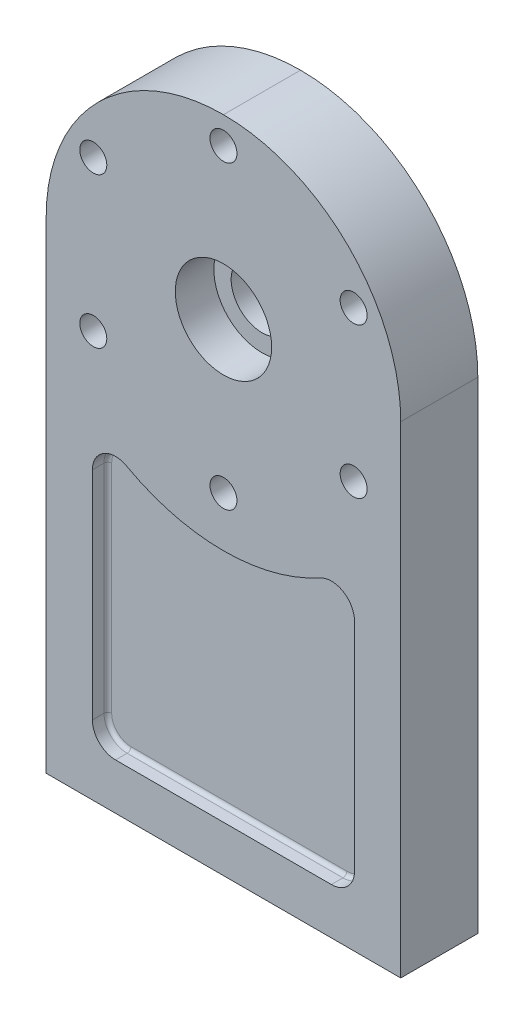
from build123d import *

# Parameters (mm, degrees)
SKETCH1_W                        = 92
SKETCH1_H                        = 171
BOSS_EXTRUDE1_DEPTH              = 10
FILLET1_R                        = 46
SKETCH3_R                        = 3.5
CUT_EXTRUDE1_DEPTH               = 100.127443223
SKETCH4_R                        = 6
CUT_EXTRUDE2_DEPTH               = 6
CIRPATTERN1_COUNT                = 6
SKETCH6_R                        = 12.5
CUT_EXTRUDE3_DEPTH               = 10
SKETCH7_R                        = 8
CUT_EXTRUDE4_DEPTH               = 100.127443223
TAP_DRILL_FOR_M10X1_5_TAP1_D     = 8.5
TAP_DRILL_FOR_M10X1_5_TAP1_DEPTH = 6
TAP_DRILL_FOR_M10X1_5_TAP1_TIP   = 4.25
CUT_EXTRUDE5_DEPTH               = 4
FILLET2_R                        = 1


with BuildPart() as part:
    # Sketch1 → Boss-Extrude1 (new, symmetric)
    with BuildSketch(Plane.XY):
        Rectangle(SKETCH1_W, SKETCH1_H)
    extrude(amount=BOSS_EXTRUDE1_DEPTH, both=True)

    # Fillet1
    fillet1_edges = [part.edges().sort_by_distance(p)[0] for p in [
        (46, 85.5, 0),
        (-46, 85.5, 0),
    ]]
    fillet(fillet1_edges, radius=FILLET1_R - 0.0001)  # a hair under: the kernel refuses the full size

    # Sketch3 → Cut-Extrude1 (cut, through all)
    with BuildSketch(Plane.XY.offset(10)):
        with Locations((0, 78.5)):
            Circle(SKETCH3_R)
    cut_extrude1 = extrude(amount=-CUT_EXTRUDE1_DEPTH, mode=Mode.SUBTRACT)

    # Sketch4 → Cut-Extrude2 (cut)
    with BuildSketch(Plane(origin=(0, 0, -10), x_dir=(-1, 0, 0), z_dir=(0, 0, -1))):
        with Locations((0, 78.5)):
            Circle(SKETCH4_R)
    cut_extrude2 = extrude(amount=-CUT_EXTRUDE2_DEPTH, mode=Mode.SUBTRACT)

    # CirPattern1: Cut-Extrude1, Cut-Extrude2 ×6 about axis
    cirpattern1_axis = Axis((0, 39.5, 0), (0, 0, 1))
    add([cut_extrude1.rotate(cirpattern1_axis, i * 360 / CIRPATTERN1_COUNT) for i in range(1, CIRPATTERN1_COUNT)], mode=Mode.SUBTRACT)
    add([cut_extrude2.rotate(cirpattern1_axis, i * 360 / CIRPATTERN1_COUNT) for i in range(1, CIRPATTERN1_COUNT)], mode=Mode.SUBTRACT)

    # Sketch6 → Cut-Extrude3 (cut)
    with BuildSketch(Plane.XY.offset(10)):
        with Locations((0, 39.5)):
            Circle(SKETCH6_R)
    extrude(amount=-CUT_EXTRUDE3_DEPTH, mode=Mode.SUBTRACT)

    # Sketch7 → Cut-Extrude4 (cut, through all)
    with BuildSketch(Plane.XY.offset(10)):
        with Locations((0, 39.5)):
            Circle(SKETCH7_R)
    extrude(amount=-CUT_EXTRUDE4_DEPTH, mode=Mode.SUBTRACT)

    # Tap Drill for M10x1.5 Tap1
    with Locations(Plane(origin=(0, -85.5, 0), x_dir=(-1, 0, 0), z_dir=(0, -1, 0))):
        with Locations((30, 0), (-30, 0)):
            Hole(TAP_DRILL_FOR_M10X1_5_TAP1_D / 2, depth=TAP_DRILL_FOR_M10X1_5_TAP1_DEPTH)
            with Locations((0, 0, -(TAP_DRILL_FOR_M10X1_5_TAP1_DEPTH + TAP_DRILL_FOR_M10X1_5_TAP1_TIP / 2))):  # 90° drill point
                Cone(0, TAP_DRILL_FOR_M10X1_5_TAP1_D / 2, TAP_DRILL_FOR_M10X1_5_TAP1_TIP, mode=Mode.SUBTRACT)

    # Sketch12 → Cut-Extrude5 (cut)
    with BuildSketch(Plane.XY.offset(10)):
        with BuildLine():
            Line((34, -67.5), (34, -11.293700397))
            ThreePointArc((34, -11.293700397), (31.051285766, -6.127497229), (25.103448276, -6.039179666))
            ThreePointArc((25.103448276, -6.039179666), (0, -12.5), (-25.103448276, -6.039179666))
            ThreePointArc((-25.103448276, -6.039179666), (-31.051285766, -6.127497229), (-34, -11.293700397))
            Line((-34, -11.293700397), (-34, -67.5))
            ThreePointArc((-34, -67.5), (-32.242640687, -71.742640687), (-28, -73.5))
            Line((-28, -73.5), (28, -73.5))
            ThreePointArc((28, -73.5), (32.242640687, -71.742640687), (34, -67.5))
        make_face()
    cut_extrude5 = extrude(amount=-CUT_EXTRUDE5_DEPTH, mode=Mode.SUBTRACT)

    # Mirror1: Cut-Extrude5 across plane
    add(cut_extrude5.mirror(Plane.XY), mode=Mode.SUBTRACT)

    # Fillet2
    fillet2_edges = [part.edges().sort_by_distance(p)[0] for p in [
        (32.242640687, -71.742640687, 6),
        (0, -73.5, 6),
        (-32.242640687, -71.742640687, 6),
        (-34, -39.396850198, 6),
        (-31.051285766, -6.127497229, 6),
        (0, -12.5, 6),
        (31.051285766, -6.127497229, 6),
        (34, -39.396850198, 6),
        (32.242640687, -71.742640687, -6),
        (34, -39.396850198, -6),
        (31.051285766, -6.127497229, -6),
        (0, -12.5, -6),
        (-31.051285766, -6.127497229, -6),
        (-34, -39.396850198, -6),
        (-32.242640687, -71.742640687, -6),
        (0, -73.5, -6),
    ]]
    fillet(fillet2_edges, radius=FILLET2_R)


solid = part.part
